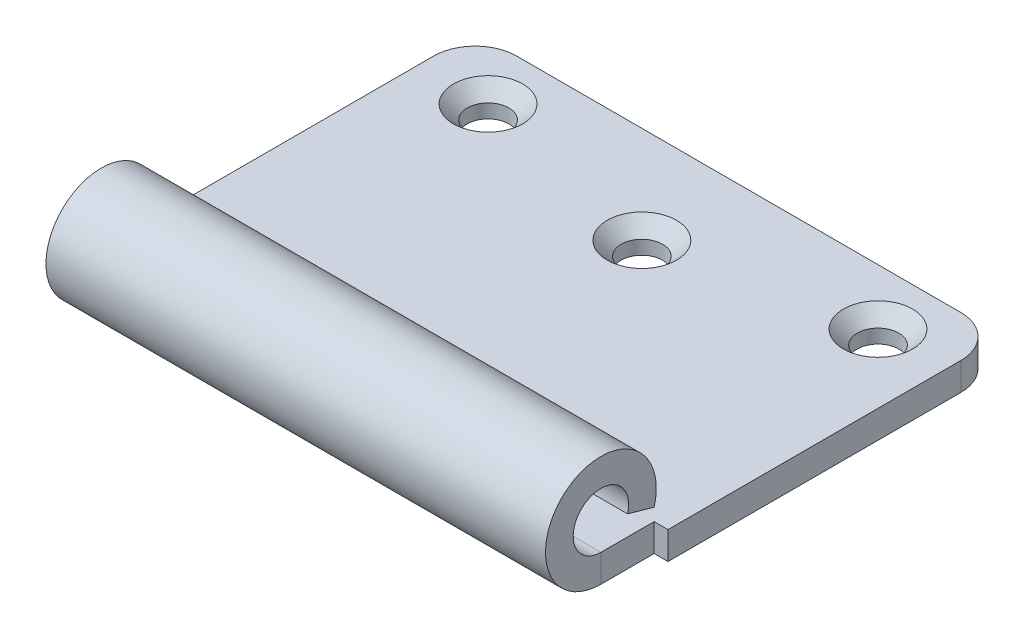
from build123d import *

# Parameters (mm, degrees)
IZIM1_R                     = 1.5
Y_KSEKLIK_EKSTR_ZYON1_DEPTH = 2
Y_KSEKLIK_EKSTR_ZYON2_DEPTH = 38.08
KAT_Y_D_N_T_R1_START        = 2
KAT_Y_D_N_T_R1_OUTLINE_W    = 38.08
KAT_Y_D_N_T_R1_OUTLINE_H    = 11
KAT_Y_D_N_T_R1_DEPTH        = 6
KENAR_START                 = -15.383826754
KENAR_EKME1_DEPTH           = 38.08
PAH2_SIZE                   = 1
KES_EKSTR_ZYON1_START       = -1
KES_EKSTR_ZYON1_DEPTH       = 1
KES_EKSTR_ZYON2_DEPTH       = 1


# Read off the part's stored shape, not the designer's step: Katıyı-Dönüştür1, Kenar Çekme1
with BuildPart() as part:
    # Çizim1 → Yükseklik-Ekstrüzyon1 (new body)
    with BuildSketch(Plane(origin=(0, 0, 0), x_dir=(1, 0, 0), z_dir=(0, 1, 0))):
        with BuildLine():
            Line((-12.383826754, -1.619350185), (-2.804796795, -1.619350185))
            Line((-2.804796795, -1.619350185), (19.696173246, -1.619350185))
            ThreePointArc((19.696173246, -1.619350185), (21.81749359, -2.498029841), (22.696173246, -4.619350185))
            Line((22.696173246, -4.619350185), (22.696173246, -24.732233603))
            Line((22.696173246, -24.732233603), (22.696173246, -29.619350185))
            Line((22.696173246, -29.619350185), (-15.383826754, -29.619350185))
            Line((-15.383826754, -29.619350185), (-15.383826754, -12.116060357))
            Line((-15.383826754, -12.116060357), (-15.383826754, -4.619350185))
            ThreePointArc((-15.383826754, -4.619350185), (-14.505147098, -2.498029841), (-12.383826754, -1.619350185))
        make_face()
        with Locations(Location((3.656173246, -8.619350185, 0), (0, 0, 270))):
            Circle(IZIM1_R, mode=Mode.SUBTRACT)
        with Locations(Location((-10.425087976, -5.646549714, 0), (0, 0, 270))):
            Circle(IZIM1_R, mode=Mode.SUBTRACT)
        with Locations(Location((17.737434468, -5.646549714, 0), (0, 0, 90))):
            Circle(IZIM1_R, mode=Mode.SUBTRACT)
    extrude(amount=Y_KSEKLIK_EKSTR_ZYON1_DEPTH)

    # Çizim2 → Yükseklik-Ekstrüzyon2 (add)
    with BuildSketch(Plane(origin=(22.696173246, 0, 0), x_dir=(0, 0, -1), z_dir=(1, 0, 0))):
        with BuildLine():
            Line((-19.271126131, 3), (-17.130193592, 3))
            ThreePointArc((-17.130193592, 3), (-23.452666681, 7.16227766), (-21.003176939, 0))
            Line((-21.003176939, 0), (-17.003176939, 0))
            Line((-17.003176939, 0), (-17.003176939, 2))
            Line((-17.003176939, 2), (-21.003176939, 2))
            ThreePointArc((-21.003176939, 2), (-22.003176939, 5.732050808), (-19.271126131, 3))
        make_face()
    extrude(amount=-Y_KSEKLIK_EKSTR_ZYON2_DEPTH)

    # Katıyı-Dönüştür1 outline → Katıyı-Dönüştür1 (cut)
    with BuildSketch(Plane(origin=(0, 0, 0), x_dir=(1, 0, 0), z_dir=(0, 1, 0)).offset(KAT_Y_D_N_T_R1_START)):
        with Locations((3.656173246, -21.5)):
            Rectangle(KAT_Y_D_N_T_R1_OUTLINE_W, KAT_Y_D_N_T_R1_OUTLINE_H)
    extrude(amount=KAT_Y_D_N_T_R1_DEPTH, mode=Mode.SUBTRACT)

    # Kenar Çekme1 outline → Kenar Çekme1 (add)
    with BuildSketch(Plane.YZ.offset(KENAR_START)):
        with BuildLine():
            Line((3.448725288, 27.696826793), (2.897450577, 25.774303401))
            ThreePointArc((2.897450577, 25.774303401), (7.19454204, 32.026610277), (0, 29.619350185))
            Line((0, 29.619350185), (2, 29.619350185))
            ThreePointArc((2, 29.619350185), (5.59727102, 30.822980231), (3.448725288, 27.696826793))
        make_face()
    extrude(amount=KENAR_EKME1_DEPTH)

    # Pah2
    pah2_edges = [part.edges().sort_by_distance(p)[0] for p in [
        (-10.425087976, 2, 4.146549714),
        (3.656173246, 2, 7.119350185),
        (17.737434468, 2, 7.146549714),
    ]]
    chamfer(pah2_edges, length=PAH2_SIZE)

    # Çizim11 → Kes-Ekstrüzyon1 (cut)
    with BuildSketch(Plane(origin=(22.696173246, 0, 0), x_dir=(0, 0, -1), z_dir=(1, 0, 0)).offset(KES_EKSTR_ZYON1_START)):
        with BuildLine():
            Line((-25.774303401, 2.897450577), (-25.774303401, 0))
            Line((-25.774303401, 0), (-29.619350185, 0))
            ThreePointArc((-29.619350185, 0), (-32.026610277, 7.19454204), (-25.774303401, 2.897450577))
        make_face()
    extrude(amount=KES_EKSTR_ZYON1_DEPTH, mode=Mode.SUBTRACT)

    # Çizim12 → Kes-Ekstrüzyon2 (cut)
    with BuildSketch(Plane.ZY.offset(15.383826754)):
        with BuildLine():
            Line((25.774303401, 2.897450577), (25.774303401, 0))
            Line((25.774303401, 0), (29.619350185, 0))
            ThreePointArc((29.619350185, 0), (32.026610277, 7.19454204), (25.774303401, 2.897450577))
        make_face()
    extrude(amount=-KES_EKSTR_ZYON2_DEPTH, mode=Mode.SUBTRACT)


solid = part.part
